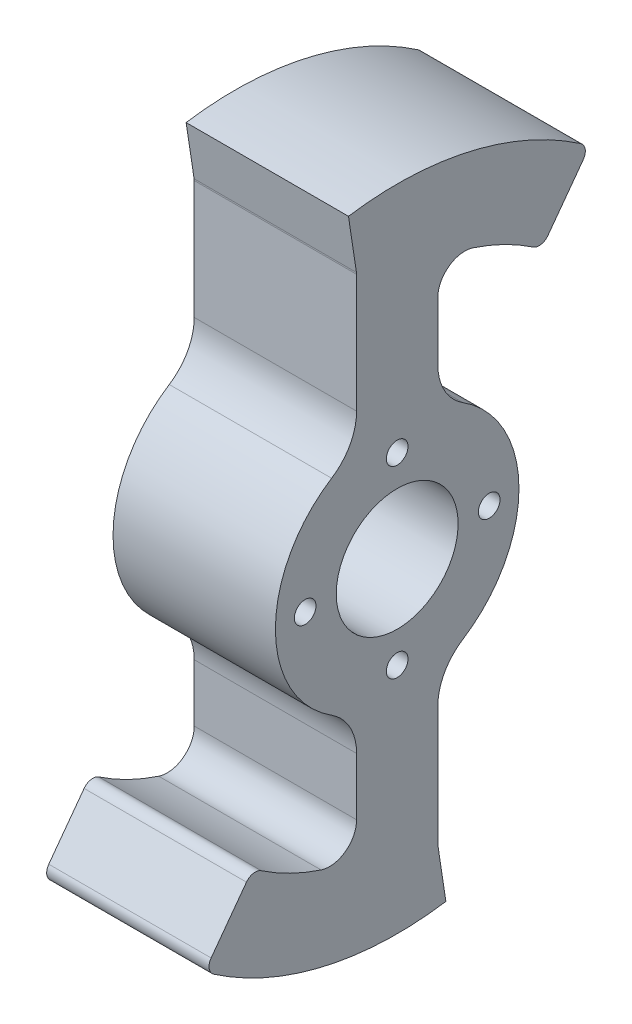
from build123d import *

# Parameters (mm, degrees)
SKETCH1_R           = 14.3002
BOSS_EXTRUDE1_DEPTH = 19.05
FILLET1_R           = 2.54
FILLET2_R           = 12.7
CUT_EXTRUDE1_REACH  = 97.956
SKETCH2_R           = 2.54


with BuildPart() as part:
    # Sketch1 → Boss-Extrude1 (new, symmetric)
    with BuildSketch(Plane(origin=(0, 0, 0), x_dir=(0, 0, -1), z_dir=(1, 0, 0))):
        with BuildLine():
            Line((-9.525, 62.781560788), (-9.525, 26.940768363))
            ThreePointArc((-9.525, 26.940768363), (-28.575, 0), (-9.525, -26.940768363))
            Line((-9.525, -26.940768363), (-9.525, -48.255822188))
            ThreePointArc((-9.525, -48.255822188), (-12.151982491, -53.399910117), (-17.859375, -54.287799961))
            ThreePointArc((-17.859375, -54.287799961), (-25.117518432, -51.334518288), (-31.903457011, -47.416156853))
            ThreePointArc((-31.903457011, -47.416156853), (-33.755745366, -47.020956128), (-35.366526812, -48.017218591))
            Line((-35.366526812, -48.017218591), (-45.189690331, -61.354151349))
            ThreePointArc((-45.189690331, -61.354151349), (-18.270612749, -73.97719047), (11.43, -75.337872946))
            Line((11.43, -75.337872946), (9.525, -62.781560788))
            Line((9.525, -62.781560788), (9.525, -26.940768363))
            ThreePointArc((9.525, -26.940768363), (28.575, 0), (9.525, 26.940768363))
            Line((9.525, 26.940768363), (9.525, 48.255822188))
            ThreePointArc((9.525, 48.255822188), (12.151982491, 53.399910117), (17.859375, 54.287799961))
            ThreePointArc((17.859375, 54.287799961), (25.117518432, 51.334518288), (31.903457011, 47.416156853))
            ThreePointArc((31.903457011, 47.416156853), (33.755745366, 47.020956128), (35.366526812, 48.017218591))
            Line((35.366526812, 48.017218591), (45.189690331, 61.354151349))
            ThreePointArc((45.189690331, 61.354151349), (18.270612749, 73.97719047), (-11.43, 75.337872946))
            Line((-11.43, 75.337872946), (-9.525, 62.781560788))
        make_face()
        Circle(SKETCH1_R, mode=Mode.SUBTRACT)
    extrude(amount=BOSS_EXTRUDE1_DEPTH, both=True)

    # Fillet1
    fillet1_edges = [part.edges().sort_by_distance(p)[0] for p in [
        (0, -61.354151349, 45.189690331),
        (0, 61.354151349, -45.189690331),
        (0, -62.781560788, -9.525),
        (0, 62.781560788, 9.525),
    ]]
    fillet(fillet1_edges, radius=FILLET1_R)

    # Fillet2
    fillet2_edges = [part.edges().sort_by_distance(p)[0] for p in [
        (0, 26.940768363, -9.525),
        (0, -26.940768363, -9.525),
        (0, -26.940768363, 9.525),
        (0, 26.940768363, 9.525),
    ]]
    fillet(fillet2_edges, radius=FILLET2_R)

    # Sketch2 → Cut-Extrude1 (cut, up to next)
    with BuildSketch(Plane.ZY.offset(19.05), mode=Mode.PRIVATE) as cut_extrude1_sk1:
        with Locations((0, 21.59)):
            Circle(SKETCH2_R)
    cut_extrude1_tool1 = extrude(cut_extrude1_sk1.sketch, amount=-CUT_EXTRUDE1_REACH, mode=Mode.PRIVATE) & part.part
    # Sketch2 → Cut-Extrude1 (cut, up to next)
    with BuildSketch(Plane.ZY.offset(19.05), mode=Mode.PRIVATE) as cut_extrude1_sk2:
        with Locations((21.59, 0)):
            Circle(SKETCH2_R)
    cut_extrude1_tool2 = extrude(cut_extrude1_sk2.sketch, amount=-CUT_EXTRUDE1_REACH, mode=Mode.PRIVATE) & part.part
    # Sketch2 → Cut-Extrude1 (cut, up to next)
    with BuildSketch(Plane.ZY.offset(19.05), mode=Mode.PRIVATE) as cut_extrude1_sk3:
        with Locations((0, -21.59)):
            Circle(SKETCH2_R)
    cut_extrude1_tool3 = extrude(cut_extrude1_sk3.sketch, amount=-CUT_EXTRUDE1_REACH, mode=Mode.PRIVATE) & part.part
    # Sketch2 → Cut-Extrude1 (cut, up to next)
    with BuildSketch(Plane.ZY.offset(19.05), mode=Mode.PRIVATE) as cut_extrude1_sk4:
        with Locations((-21.59, 0)):
            Circle(SKETCH2_R)
    cut_extrude1_tool4 = extrude(cut_extrude1_sk4.sketch, amount=-CUT_EXTRUDE1_REACH, mode=Mode.PRIVATE) & part.part
    add(cut_extrude1_tool1.solids().sort_by_distance((-19.05, 21.59, 0))[0], mode=Mode.SUBTRACT)
    add(cut_extrude1_tool2.solids().sort_by_distance((-19.05, 0, 21.59))[0], mode=Mode.SUBTRACT)
    add(cut_extrude1_tool3.solids().sort_by_distance((-19.05, -21.59, 0))[0], mode=Mode.SUBTRACT)
    add(cut_extrude1_tool4.solids().sort_by_distance((-19.05, 0, -21.59))[0], mode=Mode.SUBTRACT)


solid = part.part
